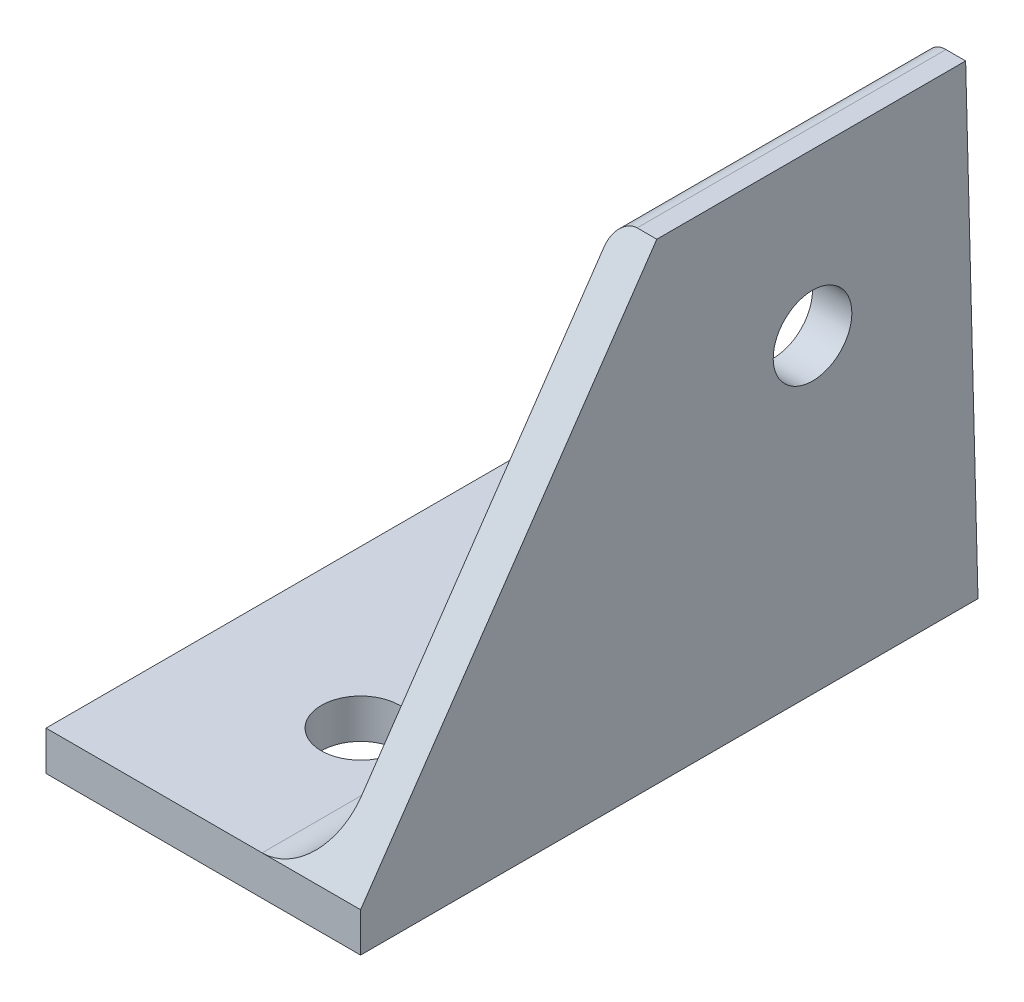
from build123d import *

# Parameters (mm, degrees)
BOSS_EXTRUDE1_DEPTH = 25.4
SKETCH3_R           = 3.175
SKETCH3_W           = 12.7
SKETCH3_H           = 50.8
CUT_EXTRUDE1_DEPTH  = 50.595085442
SKETCH12_OUTSIDE_W  = 66.478
SKETCH12_OUTSIDE_H  = 53.778
CUT_EXTRUDE2_DEPTH  = 41.659838908
SKETCH13_R          = 3.175
CUT_EXTRUDE3_DEPTH  = 41.659838908
SKETCH14_R          = 6.35
CUT_EXTRUDE4_DEPTH  = 2.54


with BuildPart() as part:
    # Sketch2 → Boss-Extrude1 (new, symmetric)
    with BuildSketch(Plane.XY):
        with BuildLine():
            Line((-19.05, -19.05), (19.05, -19.05))
            Line((19.05, -19.05), (19.05, 19.05))
            Line((19.05, 19.05), (17.4625, 19.05))
            ThreePointArc((17.4625, 19.05), (16.339967985, 18.585032015), (15.875, 17.4625))
            Line((15.875, 17.4625), (15.875, -11.0998))
            ThreePointArc((15.875, -11.0998), (14.476376302, -14.476376302), (11.0998, -15.875))
            Line((11.0998, -15.875), (-17.4625, -15.875))
            ThreePointArc((-17.4625, -15.875), (-18.585032015, -16.339967985), (-19.05, -17.4625))
            Line((-19.05, -17.4625), (-19.05, -19.05))
        make_face()
    extrude(amount=BOSS_EXTRUDE1_DEPTH, both=True)

    # Sketch3 → Cut-Extrude1 (cut, through all)
    with BuildSketch(Plane.XZ.offset(19.05)):
        with Locations((6.35, 12.7)):
            Circle(SKETCH3_R)
        with Locations((6.35, -12.7)):
            Circle(SKETCH3_R)
        with Locations((-12.7, 0)):
            Rectangle(SKETCH3_W, SKETCH3_H)
    extrude(amount=-CUT_EXTRUDE1_DEPTH, mode=Mode.SUBTRACT)

    # Sketch12 outside → Cut-Extrude2 (cut, through all)
    with BuildSketch(Plane(origin=(19.05, 0, 0), x_dir=(0, 0, -1), z_dir=(1, 0, 0))):
        Rectangle(SKETCH12_OUTSIDE_W, SKETCH12_OUTSIDE_H)
        Polygon((23.451834826, 19.05), (24.449518438, -19.05), (-25.4, -19.05), (-25.4, -15.875), (-1.48415665, 19.05), align=None, mode=Mode.SUBTRACT)
    extrude(amount=-CUT_EXTRUDE2_DEPTH, mode=Mode.SUBTRACT)

    # Sketch13 → Cut-Extrude3 (cut, through all)
    with BuildSketch(Plane(origin=(19.05, 0, 0), x_dir=(0, 0, -1), z_dir=(1, 0, 0))):
        with Locations((11.088634042, 6.021904729)):
            Circle(SKETCH13_R)
    extrude(amount=-CUT_EXTRUDE3_DEPTH, mode=Mode.SUBTRACT)

    # Sketch14 → Cut-Extrude4 (cut)
    with BuildSketch(Plane(origin=(0, -15.875, 0), x_dir=(1, 0, 0), z_dir=(0, 1, 0))):
        with Locations((6.35, -12.7)):
            Circle(SKETCH14_R)
        with Locations((6.35, 12.7)):
            Circle(SKETCH14_R)
    extrude(amount=CUT_EXTRUDE4_DEPTH, mode=Mode.SUBTRACT)


solid = part.part
